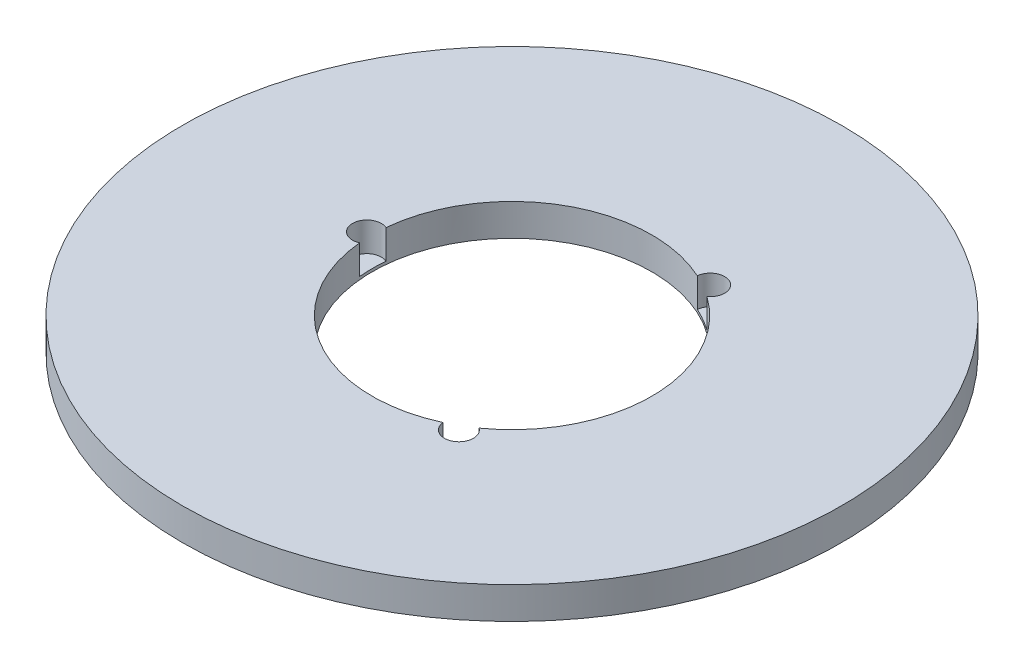
from build123d import *

# Parameters (mm, degrees)
SKETCH1_R           = 82.5
BOSS_EXTRUDE1_DEPTH = 8
SKETCH2_R           = 35
CUT_EXTRUDE1_DEPTH  = 117.946568996
SKETCH3_R           = 3.621742951
CUT_EXTRUDE2_DEPTH  = 7.301638906
CIRPATTERN1_COUNT   = 3


with BuildPart() as part:
    # Sketch1 → Boss-Extrude1 (new body)
    with BuildSketch(Plane(origin=(0, 0, 0), x_dir=(1, 0, 0), z_dir=(0, 1, 0))):
        Circle(SKETCH1_R)
    extrude(amount=BOSS_EXTRUDE1_DEPTH)

    # Sketch2 → Cut-Extrude1 (cut, through all)
    with BuildSketch(Plane(origin=(0, 0, 0), x_dir=(1, 0, 0), z_dir=(0, 1, 0))):
        Circle(SKETCH2_R)
    extrude(amount=CUT_EXTRUDE1_DEPTH, mode=Mode.SUBTRACT)

    # Sketch3 → Cut-Extrude2 (cut)
    with BuildSketch(Plane(origin=(0, 8, 0), x_dir=(1, 0, 0), z_dir=(0, 1, 0))):
        with Locations((-36.31964846, 0)):
            Circle(SKETCH3_R)
    cut_extrude2 = extrude(amount=-CUT_EXTRUDE2_DEPTH, mode=Mode.SUBTRACT)

    # CirPattern1: Cut-Extrude2 ×3 about axis
    cirpattern1_axis = Axis((0, 0, 0), (0, 1, 0))
    for i in range(1, CIRPATTERN1_COUNT):
        add(cut_extrude2.rotate(cirpattern1_axis, i * 360 / CIRPATTERN1_COUNT), mode=Mode.SUBTRACT)


solid = part.part
